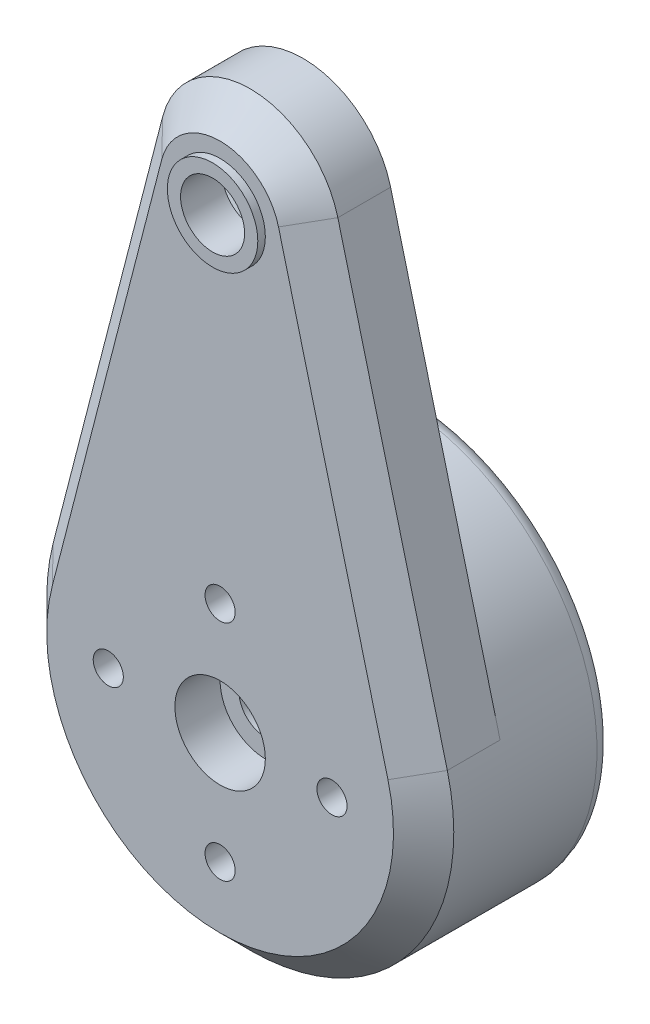
from build123d import *

# Parameters (mm, degrees)
SKETCH1_R           = 2.125
BOSS_EXTRUDE1_DEPTH = 5.5
BOSS_EXTRUDE2_START = 7
SKETCH4_R           = 13.5
BOSS_EXTRUDE2_DEPTH = 7
SKETCH6_R           = 11
CUT_EXTRUDE4_DEPTH  = 4
SKETCH5_R           = 1
SKETCH5_R_2         = 1.75
CUT_EXTRUDE2_DEPTH  = 40.376388864
CHAMFER1_SIZE       = 2
SKETCH7_R           = 3
CUT_EXTRUDE5_DEPTH  = 3
FILLET1_R           = 1
SKETCH8_R           = 3
SKETCH8_R_2         = 2.125
BOSS_EXTRUDE3_DEPTH = 0.5
CUT_EXTRUDE6_DEPTH  = 3.25
FILLET2_R           = 0.5


with BuildPart() as part:
    # Sketch1 → Boss-Extrude1 (new body)
    with BuildSketch(Plane.XY):
        with BuildLine():
            Line((-5.809475019, 31.5), (-13.071318793, 3.375))
            ThreePointArc((-13.071318793, 3.375), (0, -13.5), (13.071318793, 3.375))
            Line((13.071318793, 3.375), (5.809475019, 31.5))
            ThreePointArc((5.809475019, 31.5), (0, 36), (-5.809475019, 31.5))
        make_face()
        with Locations((0, 30)):
            Circle(SKETCH1_R, mode=Mode.SUBTRACT)
    extrude(amount=BOSS_EXTRUDE1_DEPTH)

    # Sketch4 → Boss-Extrude2 (add)
    with BuildSketch(Plane(origin=(0, 0, 0), x_dir=(-1, 0, 0), z_dir=(0, 0, -1)).offset(BOSS_EXTRUDE2_START)):
        Circle(SKETCH4_R)
    extrude(amount=-BOSS_EXTRUDE2_DEPTH)

    # Sketch6 → Cut-Extrude4 (cut)
    with BuildSketch(Plane(origin=(0, 0, -7), x_dir=(-1, 0, 0), z_dir=(0, 0, -1))):
        Circle(SKETCH6_R)
    extrude(amount=-CUT_EXTRUDE4_DEPTH, mode=Mode.SUBTRACT)

    # Sketch5 → Cut-Extrude2 (cut, through all)
    with BuildSketch(Plane(origin=(0, 0, -3), x_dir=(-1, 0, 0), z_dir=(0, 0, -1))):
        with Locations((7.42, 0)):
            Circle(SKETCH5_R)
        with Locations((0, -7.42)):
            Circle(SKETCH5_R)
        with Locations((-7.42, 0)):
            Circle(SKETCH5_R)
        with Locations((0, 7.42)):
            Circle(SKETCH5_R)
        Circle(SKETCH5_R_2)
    extrude(amount=-CUT_EXTRUDE2_DEPTH, mode=Mode.SUBTRACT)

    # Chamfer1
    chamfer1_edges = [part.edges().sort_by_distance(p)[0] for p in [
        (0, -13.5, 5.5),
        (-9.440396906, 17.4375, 5.5),
        (0, 36, 5.5),
        (9.440396906, 17.4375, 5.5),
    ]]
    chamfer(chamfer1_edges, length=CHAMFER1_SIZE)

    # Sketch7 → Cut-Extrude5 (cut)
    with BuildSketch(Plane.XY.offset(5.5)):
        Circle(SKETCH7_R)
    extrude(amount=-CUT_EXTRUDE5_DEPTH, mode=Mode.SUBTRACT)

    # Fillet1
    fillet1_edges = [part.edges().sort_by_distance(p)[0] for p in [
        (13.5, 0, -7),
    ]]
    fillet(fillet1_edges, radius=FILLET1_R)

    # Sketch8 → Boss-Extrude3 (add)
    with BuildSketch(Plane.XY.offset(5.5)):
        with Locations((0, 30)):
            Circle(SKETCH8_R)
        with Locations((0, 30)):
            Circle(SKETCH8_R_2, mode=Mode.SUBTRACT)
    extrude(amount=BOSS_EXTRUDE3_DEPTH)

    # Sketch9 → Cut-Extrude6 (cut)
    with BuildSketch(Plane(origin=(0, 0, 0), x_dir=(-1, 0, 0), z_dir=(0, 0, -1))):
        Polygon((0, 25.669872981), (3.75, 27.834936491), (3.75, 32.165063509), (0, 34.330127019), (-3.75, 32.165063509), (-3.75, 27.834936491), align=None)
    extrude(amount=-CUT_EXTRUDE6_DEPTH, mode=Mode.SUBTRACT)

    # Fillet2
    fillet2_edges = [part.edges().sort_by_distance(p)[0] for p in [
        (3.75, 30, 0),
        (1.875, 26.752404736, 0),
        (-1.875, 26.752404736, 0),
        (-3.75, 30, 0),
        (-1.875, 33.247595264, 0),
        (1.875, 33.247595264, 0),
    ]]
    fillet(fillet2_edges, radius=FILLET2_R)


solid = part.part
